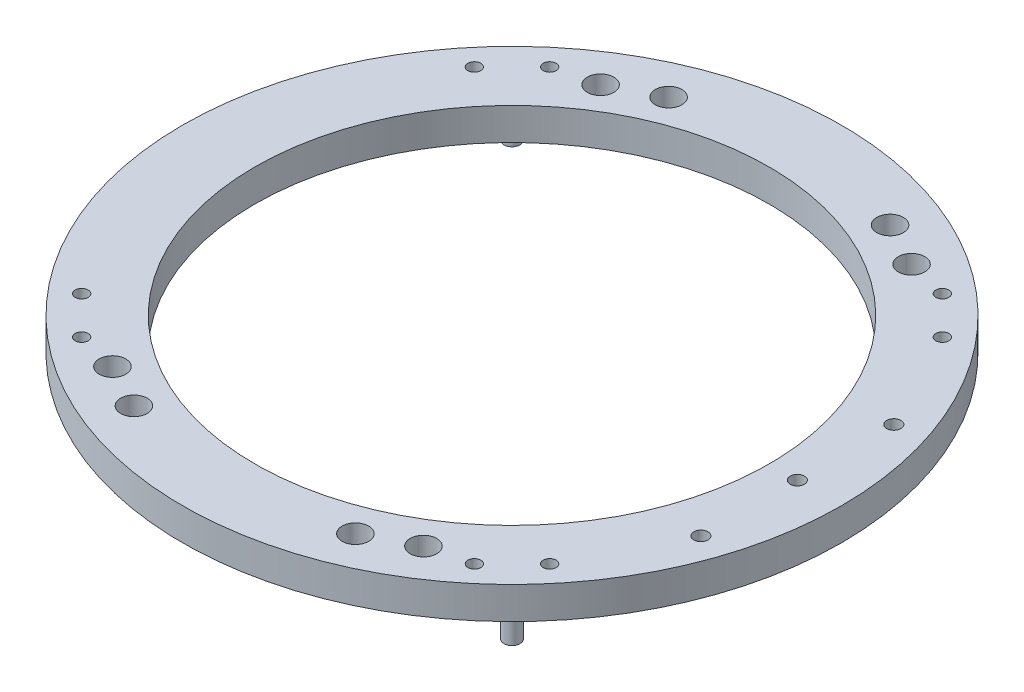
from build123d import *

# Parameters (mm, degrees)
SKETCH6_R                = 3.175
BOSS_EXTRUDE1_DEPTH      = 12.7
F_1_4_20_TAPPED_HOLE1_D  = 5.1054
CIRPATTERN1_COUNT        = 4
F_10_CLEARANCE_HOLE1_D   = 5.6134
Z_0_413_DIAMETER_HOLE1_D = 10.4902


with BuildPart() as part:
    # Sketch1 → Revolve1 (revolve)
    with BuildSketch(Plane.XY):
        Polygon((101.6, 1069.975), (101.6, 1057.275), (114.3, 1057.275), (130.175, 1057.275), (130.175, 1069.975), align=None)
    revolve(axis=Axis((0, 1125.81516809, 0), (0, -1, 0)))

    # Sketch6 → Boss-Extrude1 (add)
    with BuildSketch(Plane.XZ.offset(-1057.275)):
        with Locations((-85.31243315, 85.31243315)):
            Circle(SKETCH6_R)
        with Locations((85.31243315, 85.31243315)):
            Circle(SKETCH6_R)
        with Locations((85.31243315, -85.31243315)):
            Circle(SKETCH6_R)
        with Locations((-85.31243315, -85.31243315)):
            Circle(SKETCH6_R)
    extrude(amount=BOSS_EXTRUDE1_DEPTH)

    # 1/4-20 Tapped Hole1 (through all)
    with Locations(Plane(origin=(0, 1057.275, 0), x_dir=(-1, 0, 0), z_dir=(0, -1, 0))):
        with Locations((77.552325109, 92.423262062), (92.423262062, 77.552325109)):
            f_1_4_20_tapped_hole1 = Hole(F_1_4_20_TAPPED_HOLE1_D / 2)

    # CirPattern1: 1/4-20 Tapped Hole1 ×4 about axis
    cirpattern1_axis = Axis((0, 1125.81516809, 0), (0, 1, 0))
    for i in range(1, CIRPATTERN1_COUNT):
        add(f_1_4_20_tapped_hole1.rotate(cirpattern1_axis, i * 360 / CIRPATTERN1_COUNT), mode=Mode.SUBTRACT)

    # #10 Clearance Hole1 (through all)
    with Locations(Plane(origin=(0, 1069.975, 0), x_dir=(1, 0, 0), z_dir=(0, 1, 0))):
        with Locations((112.7125, 38.1), (112.7125, 0), (112.7125, -38.1)):
            Hole(F_10_CLEARANCE_HOLE1_D / 2)

    # Z (0.413) Diameter Hole1 (through all)
    with Locations(Plane(origin=(0, 1069.975, 0), x_dir=(1, 0, 0), z_dir=(0, 1, 0))):
        with Locations((-43.740716319, -105.599430566), (43.740716319, -105.599430566), (43.740716319, 105.599430566), (-43.740716319, 105.599430566), (-61.413345234, 96.399642256), (61.413345234, 96.399642256), (61.413345234, -96.399642256), (-61.413345234, -96.399642256)):
            Hole(Z_0_413_DIAMETER_HOLE1_D / 2)


solid = part.part
